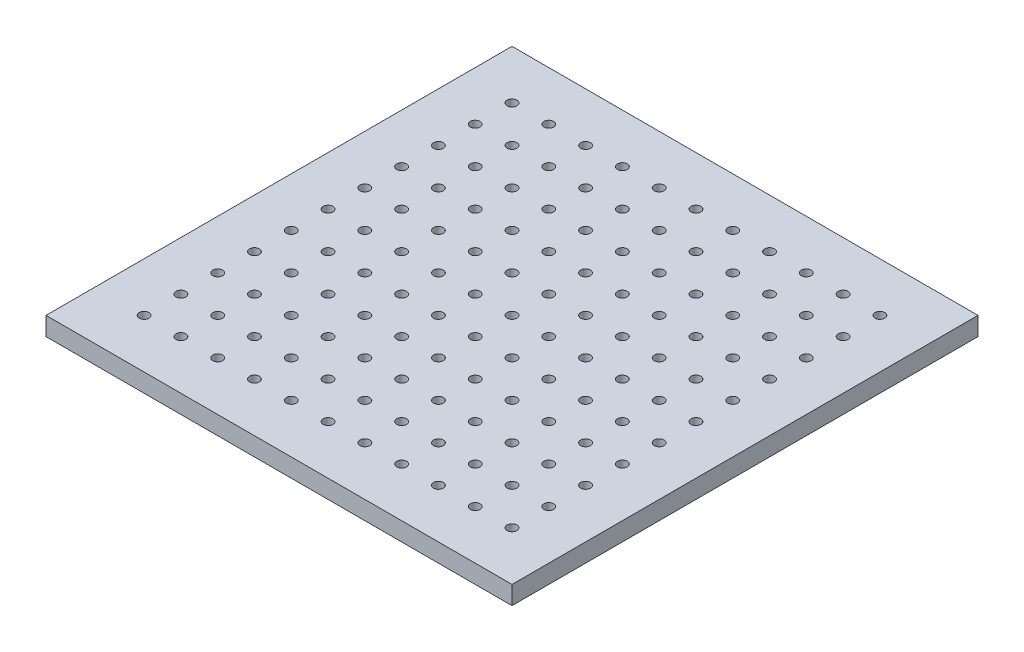
from build123d import *

# Parameters (mm, degrees)
ESBO_O1_W                 = 380
ESBO_O1_H                 = 380
RESSALTO_EXTRUS_O1_DEPTH  = 15
ESBO_O2_R                 = 4
CORTE_EXTRUS_O1_DEPTH     = 270.118932816
PADR_O_LINEAR1_COUNT      = 11
PADR_O_LINEAR1_PITCH      = 30
PADR_O_LINEAR1_COUNT_DIR2 = 11
PADR_O_LINEAR1_PITCH_DIR2 = 30


with BuildPart() as part:
    # Esboço1 → Ressalto-extrusão1 (new body)
    with BuildSketch(Plane(origin=(0, 0, 0), x_dir=(1, 0, 0), z_dir=(0, 1, 0))):
        Rectangle(ESBO_O1_W, ESBO_O1_H)
    extrude(amount=RESSALTO_EXTRUS_O1_DEPTH)

    # Esboço2 → Corte-extrusão1 (cut, through all)
    with BuildSketch(Plane(origin=(0, 15, 0), x_dir=(1, 0, 0), z_dir=(0, 1, 0))):
        with Locations((-150, -150)):
            Circle(ESBO_O2_R)
    corte_extrus_o1 = extrude(amount=-CORTE_EXTRUS_O1_DEPTH, mode=Mode.SUBTRACT)

    # Padrão linear1: Corte-extrus_o1 11 × 11
    with Locations(*[(i * PADR_O_LINEAR1_PITCH, 0, -j * PADR_O_LINEAR1_PITCH_DIR2) for i in range(PADR_O_LINEAR1_COUNT) for j in range(PADR_O_LINEAR1_COUNT_DIR2) if (i, j) != (0, 0)]):
        add(corte_extrus_o1, mode=Mode.SUBTRACT)


solid = part.part
